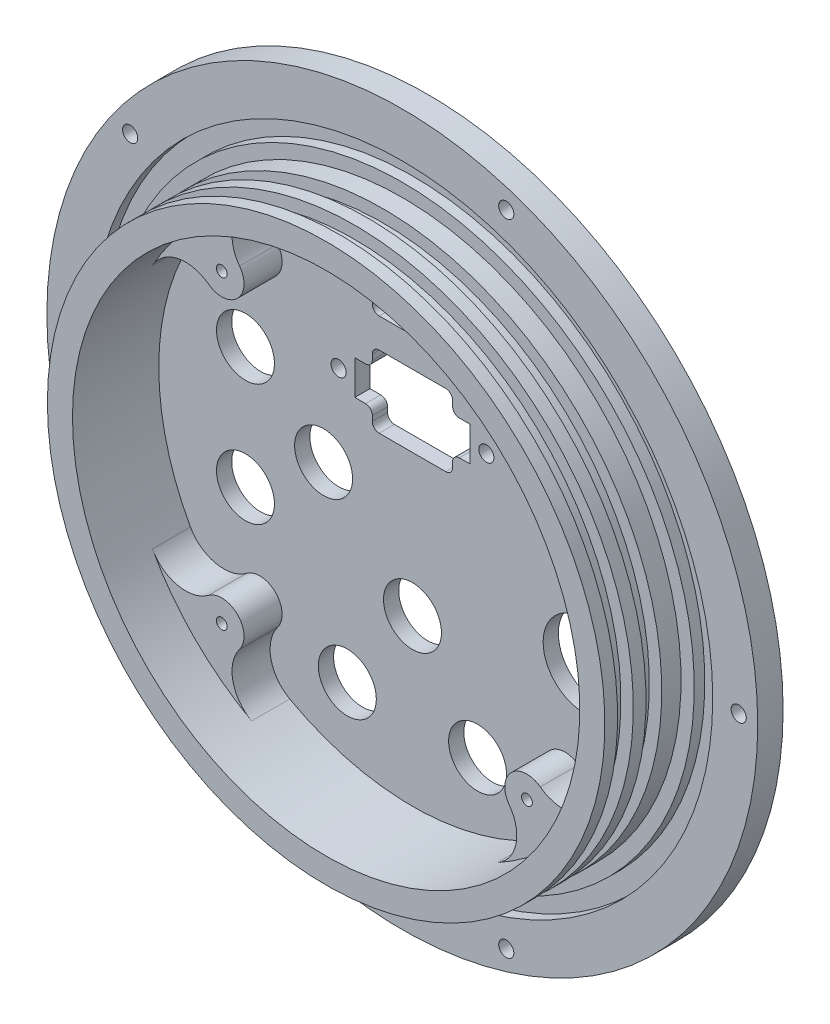
from build123d import *

# Parameters (mm, degrees)
F_6_CLEARANCE_HOLE1_D      = 3.7973
F_6_CLEARANCE_HOLE1_DEPTH  = 25.4
F_6_CLEARANCE_HOLE1_TIP    = 1.140824014
CUT_EXTRUDE1_DEPTH         = 128.563898106
F_6_CLEARANCE_HOLE2_D      = 3.7973
F_6_CLEARANCE_HOLE2_DEPTH  = 7.874
F_6_CLEARANCE_HOLE2_TIP    = 1.140824014
SKETCH11_R                 = 5.55625
BOSS_EXTRUDE1_DEPTH        = 9.525
CUT_EXTRUDE2_DEPTH         = 128.563898106
FILLET1_R                  = 9.525
M16X1_5_TAPPED_HOLE1_D     = 14.5
M16X1_5_TAPPED_HOLE1_DEPTH = 36.576
M16X1_5_TAPPED_HOLE1_TIP   = 4.356239488
F_6_32_TAPPED_HOLE2_D      = 2.7051
F_6_32_TAPPED_HOLE2_DEPTH  = 9.398
F_6_32_TAPPED_HOLE2_TIP    = 0.81269403


with BuildPart() as part:
    # Sketch1 → Revolve1 (revolve)
    with BuildSketch(Plane(origin=(0, 0, 0), x_dir=(1, 0, 0), z_dir=(0, 1, 0)), mode=Mode.PRIVATE) as revolve1_sk:
        Polygon((0, 0), (88.9, 0), (88.9, -6.35), (77.6478, -6.35), (77.6478, -3.7084), (73.025, -3.7084), (73.025, -6.35), (69.723, -6.35), (69.723, -11.176), (66.6242, -11.176), (66.6242, -15.113), (69.723, -15.113), (69.723, -18.288), (66.6242, -18.288), (66.6242, -22.225), (69.723, -22.225), (69.723, -25.4), (63.4492, -25.4), (63.4492, -3.81), (0, -3.81), align=None)
    revolve(revolve1_sk.sketch.rotate(Axis((0, 0, 0), (0, 0, 1)), 180), axis=Axis((0, 0, 0), (0, 0, 1)))

    # #6 Clearance Hole1
    with Locations(Plane.XY.offset(6.35)):
        with Locations((84.1375, 0), (25.999917364, -80.01951764), (-68.068667364, -49.454781665), (-68.068667364, 49.454781665), (25.999917364, 80.01951764)):
            Hole(F_6_CLEARANCE_HOLE1_D / 2, depth=F_6_CLEARANCE_HOLE1_DEPTH)
            with Locations((0, 0, -(F_6_CLEARANCE_HOLE1_DEPTH + F_6_CLEARANCE_HOLE1_TIP / 2))):  # 118° drill point
                Cone(0, F_6_CLEARANCE_HOLE1_D / 2, F_6_CLEARANCE_HOLE1_TIP, mode=Mode.SUBTRACT)

    # Sketch4 → Cut-Extrude1 (cut, through all)
    with BuildSketch(Plane.XY.offset(3.81)):
        with BuildLine():
            ThreePointArc((-11.7348, 26.5303), (-10.53144568, 27.02874568), (-10.033, 28.2321))
            Line((-10.033, 28.2321), (-10.033, 29.5275))
            ThreePointArc((-10.033, 29.5275), (-9.53455432, 30.73085432), (-8.3312, 31.2293))
            Line((-8.3312, 31.2293), (8.3312, 31.2293))
            ThreePointArc((8.3312, 31.2293), (9.53455432, 30.73085432), (10.033, 29.5275))
            Line((10.033, 29.5275), (10.033, 28.2321))
            ThreePointArc((10.033, 28.2321), (10.53144568, 27.02874568), (11.7348, 26.5303))
            Line((11.7348, 26.5303), (14.4272, 26.5303))
            Line((14.4272, 26.5303), (14.4272, 17.9197))
            Line((14.4272, 17.9197), (11.7348, 17.9197))
            ThreePointArc((11.7348, 17.9197), (10.53144568, 17.42125432), (10.033, 16.2179))
            Line((10.033, 16.2179), (10.033, 14.9225))
            ThreePointArc((10.033, 14.9225), (9.53455432, 13.71914568), (8.3312, 13.2207))
            Line((8.3312, 13.2207), (-8.3312, 13.2207))
            ThreePointArc((-8.3312, 13.2207), (-9.53455432, 13.71914568), (-10.033, 14.9225))
            Line((-10.033, 14.9225), (-10.033, 16.2179))
            ThreePointArc((-10.033, 16.2179), (-10.53144568, 17.42125432), (-11.7348, 17.9197))
            Line((-11.7348, 17.9197), (-14.4272, 17.9197))
            Line((-14.4272, 17.9197), (-14.4272, 26.5303))
            Line((-14.4272, 26.5303), (-11.7348, 26.5303))
        make_face()
        with BuildLine():
            Line((8.3312, 56.6293), (-8.3312, 56.6293))
            ThreePointArc((-8.3312, 56.6293), (-9.53455432, 56.13085432), (-10.033, 54.9275))
            Line((-10.033, 54.9275), (-10.033, 53.6321))
            ThreePointArc((-10.033, 53.6321), (-10.53144568, 52.42874568), (-11.7348, 51.9303))
            Line((-11.7348, 51.9303), (-14.4272, 51.9303))
            Line((-14.4272, 51.9303), (-14.4272, 43.3197))
            Line((-14.4272, 43.3197), (-11.7348, 43.3197))
            ThreePointArc((-11.7348, 43.3197), (-10.53144568, 42.82125432), (-10.033, 41.6179))
            Line((-10.033, 41.6179), (-10.033, 40.3225))
            ThreePointArc((-10.033, 40.3225), (-9.53455432, 39.11914568), (-8.3312, 38.6207))
            Line((-8.3312, 38.6207), (8.3312, 38.6207))
            ThreePointArc((8.3312, 38.6207), (9.53455432, 39.11914568), (10.033, 40.3225))
            Line((10.033, 40.3225), (10.033, 41.6179))
            ThreePointArc((10.033, 41.6179), (10.53144568, 42.82125432), (11.7348, 43.3197))
            Line((11.7348, 43.3197), (14.4272, 43.3197))
            Line((14.4272, 43.3197), (14.4272, 51.9303))
            Line((14.4272, 51.9303), (11.7348, 51.9303))
            ThreePointArc((11.7348, 51.9303), (10.53144568, 52.42874568), (10.033, 53.6321))
            Line((10.033, 53.6321), (10.033, 54.9275))
            ThreePointArc((10.033, 54.9275), (9.53455432, 56.13085432), (8.3312, 56.6293))
        make_face()
    extrude(amount=-CUT_EXTRUDE1_DEPTH, mode=Mode.SUBTRACT)

    # #6 Clearance Hole2
    with Locations(Plane.XY.offset(3.81)):
        with Locations((-18.4785, 47.625), (18.4785, 47.625), (-18.4785, 22.225), (18.4785, 22.225)):
            Hole(F_6_CLEARANCE_HOLE2_D / 2, depth=F_6_CLEARANCE_HOLE2_DEPTH)
            with Locations((0, 0, -(F_6_CLEARANCE_HOLE2_DEPTH + F_6_CLEARANCE_HOLE2_TIP / 2))):  # 118° drill point
                Cone(0, F_6_CLEARANCE_HOLE2_D / 2, F_6_CLEARANCE_HOLE2_TIP, mode=Mode.SUBTRACT)

    # Sketch11 → Boss-Extrude1 (add)
    with BuildSketch(Plane.XY.offset(3.81)):
        with BuildLine():
            Line((-48.930669698, 40.392951657), (-41.887522062, 34.040213285))
            ThreePointArc((-41.887522062, 34.040213285), (-42.094950568, 42.094950568), (-34.040213285, 41.887522062))
            Line((-34.040213285, 41.887522062), (-40.392951657, 48.930669698))
            ThreePointArc((-40.392951657, 48.930669698), (-44.865359581, 44.865359581), (-48.930669698, 40.392951657))
        make_face()
        with Locations((-38.166088515, 38.166088515)):
            Circle(SKETCH11_R)
        with Locations((38.166088515, 38.166088515)):
            Circle(SKETCH11_R)
        with BuildLine():
            ThreePointArc((43.722338515, 38.166088515), (43.242954143, 35.908357473), (41.887522062, 34.040213285))
            Line((41.887522062, 34.040213285), (48.930669698, 40.392951657))
            ThreePointArc((48.930669698, 40.392951657), (44.865359581, 44.865359581), (40.392951657, 48.930669698))
            Line((40.392951657, 48.930669698), (34.040213285, 41.887522062))
            ThreePointArc((34.040213285, 41.887522062), (40.159517698, 43.352431557), (43.722338515, 38.166088515))
        make_face()
        with Locations((38.166088515, -38.166088515)):
            Circle(SKETCH11_R)
        with BuildLine():
            Line((48.930669698, -40.392951657), (41.887522062, -34.040213285))
            ThreePointArc((41.887522062, -34.040213285), (43.242954143, -35.908357473), (43.722338515, -38.166088515))
            ThreePointArc((43.722338515, -38.166088515), (40.159517698, -43.352431557), (34.040213285, -41.887522062))
            Line((34.040213285, -41.887522062), (40.392951657, -48.930669698))
            ThreePointArc((40.392951657, -48.930669698), (44.865359581, -44.865359581), (48.930669698, -40.392951657))
        make_face()
        with BuildLine():
            ThreePointArc((-34.040213285, -41.887522062), (-42.094950568, -42.094950568), (-41.887522062, -34.040213285))
            Line((-41.887522062, -34.040213285), (-48.930669698, -40.392951657))
            ThreePointArc((-48.930669698, -40.392951657), (-44.865359581, -44.865359581), (-40.392951657, -48.930669698))
            Line((-40.392951657, -48.930669698), (-34.040213285, -41.887522062))
        make_face()
        with Locations((-38.166088515, -38.166088515)):
            Circle(SKETCH11_R)
    extrude(amount=BOSS_EXTRUDE1_DEPTH)

    # Sketch7 → Cut-Extrude2 (cut, through all)
    with BuildSketch(Plane.XY.offset(3.81)):
        with BuildLine():
            Line((52.761693969, -8.591783329), (49.988858988, -18.940144357))
            ThreePointArc((49.988858988, -18.940144357), (33.035725777, -8.851896043), (52.761693969, -8.591783329))
        make_face()
    extrude(amount=-CUT_EXTRUDE2_DEPTH, mode=Mode.SUBTRACT)

    # Fillet1
    # the kernel refuses this fillet: 9.525 mm, written as the material it adds along each edge
    with BuildSketch(Plane(origin=(-48.930669698, -40.392951657, 3.81), x_dir=(-0.5625955256004904, 0.8267322871246218, 0), z_dir=(0, 0, 1)), Plane(origin=(40.392951657, -48.930669698, 3.81), x_dir=(-0.8267322871246213, -0.5625955256004911, 0), z_dir=(0, 0, 1)), Plane(origin=(48.930669698, 40.392951657, 3.81), x_dir=(0.5625955256004896, -0.8267322871246222, 0), z_dir=(0, 0, 1)), Plane(origin=(-40.392951657, 48.930669698, 3.81), x_dir=(0.8267322871246212, 0.5625955256004912, 0), z_dir=(0, 0, 1))) as fillet1_piece_1:
        with BuildLine():
            CenterArc((10.85136124, -9.484206116), FILLET1_R, 84.695337095, 97.843486082)
            Line((1.335710636, -9.906128608), (0.384145576, -9.948320857))
            ThreePointArc((0.384145576, -9.948320857), (0.345915242, -9.526322078), (-0.943655336, -0.129502341))
            Line((-0.943655336, -0.129502341), (-0.08806017, 0.948420612))
            ThreePointArc((-0.08806017, 0.948420612), (5.865981471, 1.224241662), (11.820023112, 0.948420612))
            Line((11.820023112, 0.948420612), (11.731962942, 0))
        make_face()
    extrude(amount=9.525)
    with BuildSketch(Plane(origin=(-40.392951657, -48.930669698, 3.81), x_dir=(0.826732287124621, -0.5625955256004915, 0), z_dir=(0, 0, 1)), Plane(origin=(48.930669698, -40.392951657, 3.81), x_dir=(0.5625955256004891, 0.8267322871246228, 0), z_dir=(0, 0, 1)), Plane(origin=(40.392951657, 48.930669698, 3.81), x_dir=(-0.8267322871246218, 0.5625955256004905, 0), z_dir=(0, 0, 1)), Plane(origin=(-48.930669698, 40.392951657, 3.81), x_dir=(-0.5625955256004898, -0.8267322871246221, 0), z_dir=(0, 0, 1))) as fillet1_piece_2:
        with BuildLine():
            CenterArc((10.85136124, 9.484206116), FILLET1_R, 177.461176823, 97.843486082)
            Line((1.335710636, 9.906128608), (0.384145576, 9.948320857))
            ThreePointArc((0.384145576, 9.948320857), (0.345915242, 9.526322078), (-0.943655336, 0.129502341))
            Line((-0.943655336, 0.129502341), (-0.08806017, -0.948420612))
            ThreePointArc((-0.08806017, -0.948420612), (5.865981471, -1.224241662), (11.820023112, -0.948420612))
            Line((11.820023112, -0.948420612), (11.731962942, 0))
        make_face()
    extrude(amount=9.525)

    # M16x1.5 Tapped Hole1
    with Locations(Plane.XY.offset(3.81)):
        with Locations((44.752861065, 16.288709326), (-22.225, 0), (0, -22.225), (-16.288709326, -44.752861065), (-41.769336994, 15.202795371), (-41.769336994, -15.202795371), (16.288709326, -44.752861065)):
            Hole(M16X1_5_TAPPED_HOLE1_D / 2, depth=M16X1_5_TAPPED_HOLE1_DEPTH)
            with Locations((0, 0, -(M16X1_5_TAPPED_HOLE1_DEPTH + M16X1_5_TAPPED_HOLE1_TIP / 2))):  # 118° drill point
                Cone(0, M16X1_5_TAPPED_HOLE1_D / 2, M16X1_5_TAPPED_HOLE1_TIP, mode=Mode.SUBTRACT)

    # #6-32 Tapped Hole2
    with Locations(Plane.XY.offset(13.335)):
        with Locations((-38.166088515, 38.166088515), (38.166088515, 38.166088515), (38.166088515, -38.166088515), (-38.166088515, -38.166088515)):
            Hole(F_6_32_TAPPED_HOLE2_D / 2, depth=F_6_32_TAPPED_HOLE2_DEPTH)
            with Locations((0, 0, -(F_6_32_TAPPED_HOLE2_DEPTH + F_6_32_TAPPED_HOLE2_TIP / 2))):  # 118° drill point
                Cone(0, F_6_32_TAPPED_HOLE2_D / 2, F_6_32_TAPPED_HOLE2_TIP, mode=Mode.SUBTRACT)


solid = part.part
